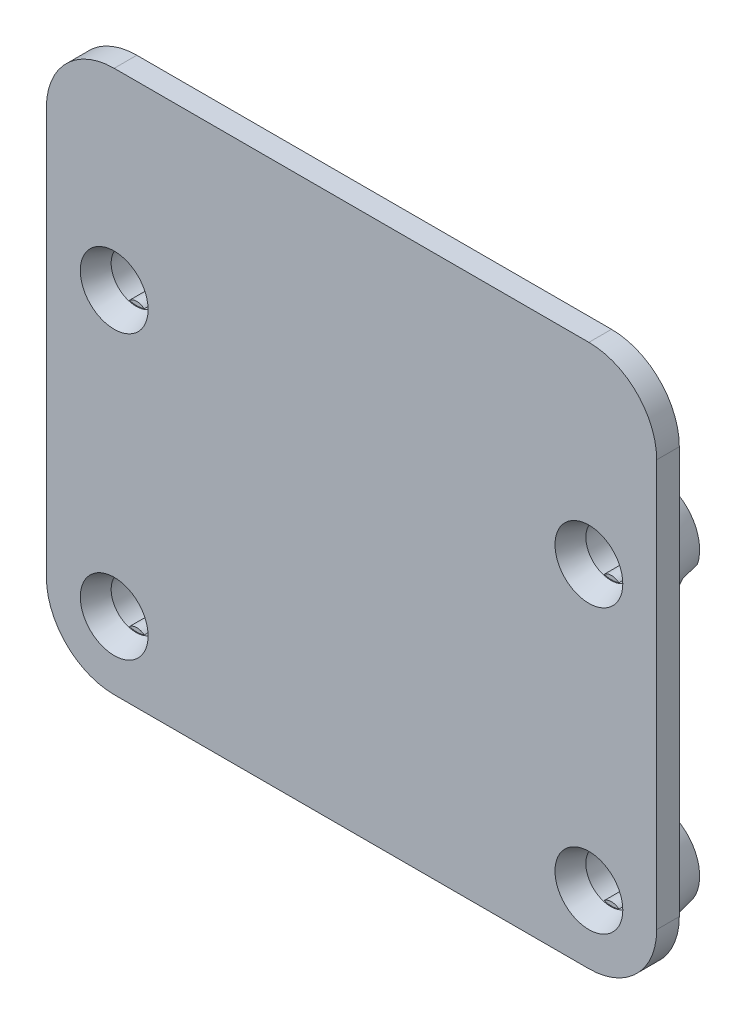
from build123d import *

# Parameters (mm, degrees)
BOSS_EXTRUDE1_DEPTH           = 1
SKETCH4_R                     = 2.3
BOSS_EXTRUDE2_DEPTH           = 2
M2_CLEARANCE_HOLE1_AT_2_COUNT = 2
M2_CLEARANCE_HOLE1_AT_2_PITCH = 12.5
M2_CLEARANCE_HOLE1_AT_3_COUNT = 2
M2_CLEARANCE_HOLE1_AT_3_PITCH = 24.43869882
M2_CLEARANCE_HOLE1_AT_4_COUNT = 2
M2_CLEARANCE_HOLE1_AT_4_PITCH = 21
BOSS_EXTRUDE3_START           = -1
BOSS_EXTRUDE3_DEPTH           = 0.75
CHAMFER1_SIZE                 = 0.4
CHAMFER1_SIZE_2               = 2
CUT_EXTRUDE2_DEPTH            = 0.8


with BuildPart() as part:
    # Sketch1 → Boss-Extrude1 (new body)
    with BuildSketch(Plane.XY):
        with BuildLine():
            Line((10.5, 12), (-10.5, 12))
            ThreePointArc((-10.5, 12), (-12.621320344, 11.121320344), (-13.5, 9))
            Line((-13.5, 9), (-13.5, -9))
            ThreePointArc((-13.5, -9), (-12.621320344, -11.121320344), (-10.5, -12))
            Line((-10.5, -12), (10.5, -12))
            ThreePointArc((10.5, -12), (12.621320344, -11.121320344), (13.5, -9))
            Line((13.5, -9), (13.5, 9))
            ThreePointArc((13.5, 9), (12.621320344, 11.121320344), (10.5, 12))
        make_face()
    extrude(amount=BOSS_EXTRUDE1_DEPTH)

    # Sketch4 → Boss-Extrude2 (add)
    with BuildSketch(Plane(origin=(0, 0, 0), x_dir=(-1, 0, 0), z_dir=(0, 0, -1))):
        with Locations((-10.5, 3.5)):
            Circle(SKETCH4_R)
        with Locations((10.5, 3.5)):
            Circle(SKETCH4_R)
        with Locations((10.5, -9)):
            Circle(SKETCH4_R)
        with Locations((-10.5, -9)):
            Circle(SKETCH4_R)
    extrude(amount=BOSS_EXTRUDE2_DEPTH)

    # Sketch3 → M2 Clearance Hole1 (revolve, cut)
    with BuildSketch(Plane(origin=(10.5, 3.5, 1), x_dir=(0, -1, 0), z_dir=(1, 0, 0))):
        Polygon((0, 0), (0, 3), (1.1, 3), (1.1, 0.965685425), (1.5, 0), align=None)
    m2_clearance_hole1 = revolve(axis=Axis((10.5, 3.5, 7.35), (0, 0, -1)), mode=Mode.SUBTRACT)

    # M2 Clearance Hole1 at 2: M2 Clearance Hole1 ×2
    with Locations(*[(0, -i * M2_CLEARANCE_HOLE1_AT_2_PITCH, 0) for i in range(1, M2_CLEARANCE_HOLE1_AT_2_COUNT)]):
        add(m2_clearance_hole1, mode=Mode.SUBTRACT)

    # M2 Clearance Hole1 at 3: M2 Clearance Hole1 ×2
    with Locations(*[Vector(-0.8592928844097065, -0.5114838597676831, 0) * (i * M2_CLEARANCE_HOLE1_AT_3_PITCH) for i in range(1, M2_CLEARANCE_HOLE1_AT_3_COUNT)]):
        add(m2_clearance_hole1, mode=Mode.SUBTRACT)

    # M2 Clearance Hole1 at 4: M2 Clearance Hole1 ×2
    with Locations(*[(-i * M2_CLEARANCE_HOLE1_AT_4_PITCH, 0, 0) for i in range(1, M2_CLEARANCE_HOLE1_AT_4_COUNT)]):
        add(m2_clearance_hole1, mode=Mode.SUBTRACT)

    # Sketch6 → Boss-Extrude3 (add)
    with BuildSketch(Plane.XY.offset(1).offset(BOSS_EXTRUDE3_START)):
        with BuildLine():
            Line((10.124367201, 2.4), (10.875632799, 2.4))
            ThreePointArc((10.875632799, 2.4), (10.5, 2.57), (10.124367201, 2.4))
        make_face()
        with BuildLine():
            Line((10.124367201, 4.6), (10.875632799, 4.6))
            ThreePointArc((10.875632799, 4.6), (10.5, 4.43), (10.124367201, 4.6))
        make_face()
        with BuildLine():
            Line((-10.124367201, 2.4), (-10.875632799, 2.4))
            ThreePointArc((-10.875632799, 2.4), (-10.5, 2.57), (-10.124367201, 2.4))
        make_face()
        with BuildLine():
            Line((-10.124367201, 4.6), (-10.875632799, 4.6))
            ThreePointArc((-10.875632799, 4.6), (-10.5, 4.43), (-10.124367201, 4.6))
        make_face()
        with BuildLine():
            Line((10.124367201, -10.1), (10.875632799, -10.1))
            ThreePointArc((10.875632799, -10.1), (10.5, -9.93), (10.124367201, -10.1))
        make_face()
        with BuildLine():
            Line((10.124367201, -7.9), (10.875632799, -7.9))
            ThreePointArc((10.875632799, -7.9), (10.5, -8.07), (10.124367201, -7.9))
        make_face()
        with BuildLine():
            Line((-10.124367201, -10.1), (-10.875632799, -10.1))
            ThreePointArc((-10.875632799, -10.1), (-10.5, -9.93), (-10.124367201, -10.1))
        make_face()
        with BuildLine():
            Line((-10.124367201, -7.9), (-10.875632799, -7.9))
            ThreePointArc((-10.875632799, -7.9), (-10.5, -8.07), (-10.124367201, -7.9))
        make_face()
    extrude(amount=-BOSS_EXTRUDE3_DEPTH)

    # Chamfer1
    # the kernel refuses this chamfer: 2, 0.4 mm, written as the material it takes off along each edge
    with BuildSketch(Plane(origin=(10.5, 3.5, -2), x_dir=(-1, 0, 0), z_dir=(0, -1, 0))) as chamfer1_piece_1_section:
        Polygon((2.3 - CHAMFER1_SIZE, 0), (2.3, -CHAMFER1_SIZE_2), (2.3, 0), align=None)
    chamfer1_piece_1 = revolve(axis=Axis((10.5, 3.5, -2), (0, 0, -1)), mode=Mode.PRIVATE)
    chamfer1_piece_1 = split(chamfer1_piece_1, bisect_by=Plane(origin=(12.610878193, 3.5, 0), z_dir=(0, 0, -1)), keep=Keep.TOP, mode=Mode.PRIVATE)
    add(chamfer1_piece_1, mode=Mode.SUBTRACT)
    with BuildSketch(Plane(origin=(-10.5, 3.5, -2), x_dir=(-1, 0, 0), z_dir=(0, -1, 0))) as chamfer1_piece_2_section:
        Polygon((2.3 - CHAMFER1_SIZE, 0), (2.3, -CHAMFER1_SIZE_2), (2.3, 0), align=None)
    chamfer1_piece_2 = revolve(axis=Axis((-10.5, 3.5, -2), (0, 0, -1)), mode=Mode.PRIVATE)
    chamfer1_piece_2 = split(chamfer1_piece_2, bisect_by=Plane(origin=(-8.389121807, 3.5, 0), z_dir=(0, 0, -1)), keep=Keep.TOP, mode=Mode.PRIVATE)
    add(chamfer1_piece_2, mode=Mode.SUBTRACT)
    with BuildSketch(Plane(origin=(-10.5, -9, -2), x_dir=(-1, 0, 0), z_dir=(0, -1, 0))) as chamfer1_piece_3_section:
        Polygon((2.3 - CHAMFER1_SIZE, 0), (2.3, -CHAMFER1_SIZE_2), (2.3, 0), align=None)
    chamfer1_piece_3 = revolve(axis=Axis((-10.5, -9, -2), (0, 0, -1)), mode=Mode.PRIVATE)
    chamfer1_piece_3 = split(chamfer1_piece_3, bisect_by=Plane(origin=(-8.389121807, -9, 0), z_dir=(0, 0, -1)), keep=Keep.TOP, mode=Mode.PRIVATE)
    add(chamfer1_piece_3, mode=Mode.SUBTRACT)
    with BuildSketch(Plane(origin=(10.5, -9, -2), x_dir=(-1, 0, 0), z_dir=(0, -1, 0))) as chamfer1_piece_4_section:
        Polygon((2.3 - CHAMFER1_SIZE, 0), (2.3, -CHAMFER1_SIZE_2), (2.3, 0), align=None)
    chamfer1_piece_4 = revolve(axis=Axis((10.5, -9, -2), (0, 0, -1)), mode=Mode.PRIVATE)
    chamfer1_piece_4 = split(chamfer1_piece_4, bisect_by=Plane(origin=(12.610878193, -9, 0), z_dir=(0, 0, -1)), keep=Keep.TOP, mode=Mode.PRIVATE)
    add(chamfer1_piece_4, mode=Mode.SUBTRACT)

    # Sketch5 → Cut-Extrude2 (cut)
    with BuildSketch(Plane(origin=(0, 0, -2), x_dir=(-1, 0, 0), z_dir=(0, 0, -1))):
        with BuildLine():
            Line((8.712564289, 4.947436899), (10.5, 3.5))
            Line((10.5, 3.5), (9.180774196, 1.615950298))
            ThreePointArc((9.180774196, 1.615950298), (8.222383442, 3.179901868), (8.712564289, 4.947436899))
        make_face()
        with BuildLine():
            Line((10.419731158, -11.298598902), (10.5, -9))
            Line((10.5, -9), (8.258948851, -9.517387425))
            ThreePointArc((8.258948851, -9.517387425), (9.037020093, -10.774736542), (10.419731158, -11.298598902))
        make_face()
        with BuildLine():
            Line((-12.674692724, 2.751193245), (-10.5, 3.5))
            Line((-10.5, 3.5), (-10.740415466, 1.212599641))
            ThreePointArc((-10.740415466, 1.212599641), (-11.931783664, 1.700001239), (-12.674692724, 2.751193245))
        make_face()
        with BuildLine():
            Line((-10.5, -6.7), (-10.5, -9))
            Line((-10.5, -9), (-8.200350301, -8.959859465))
            ThreePointArc((-8.200350301, -8.959859465), (-8.887908692, -7.359523967), (-10.5, -6.7))
        make_face()
    extrude(amount=-CUT_EXTRUDE2_DEPTH, mode=Mode.SUBTRACT)


solid = part.part
